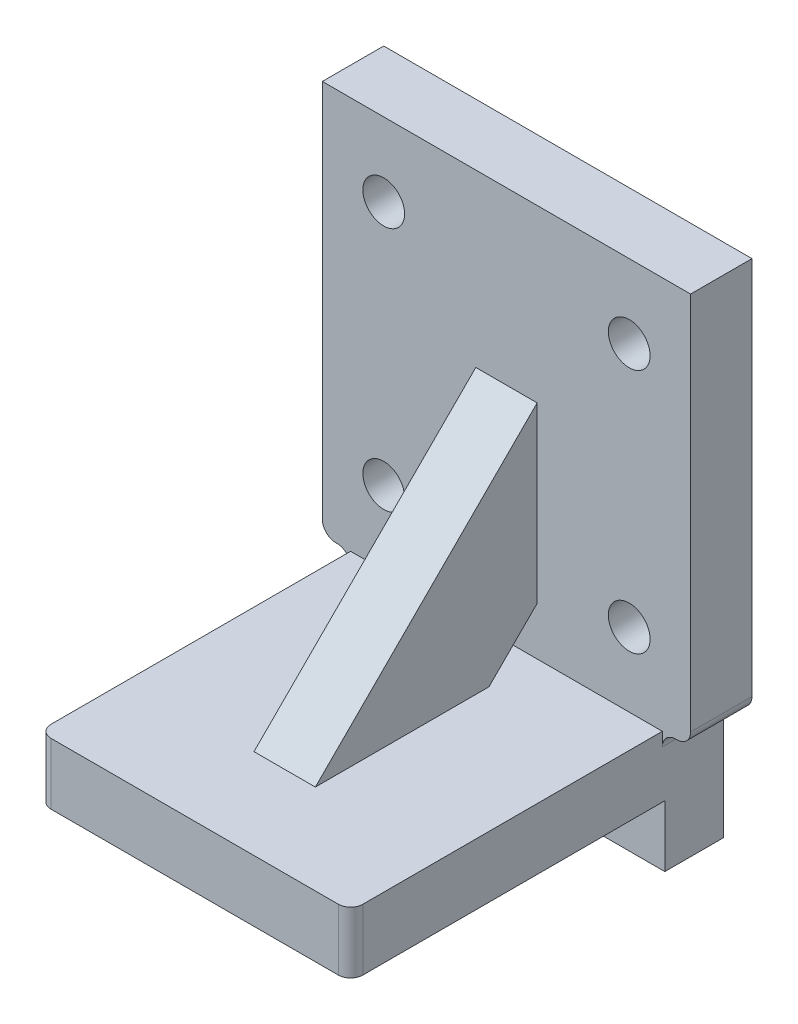
from build123d import *

# Parameters (mm, degrees)
SKETCH1_W                       = 30
SKETCH1_H                       = 32
BOSS_EXTRUDE1_DEPTH             = 5
M3_CLEARANCE_HOLE1_D            = 3.4
SKETCH5_W                       = 25.4
SKETCH5_H                       = 30.4
BOSS_EXTRUDE2_DEPTH             = 5
BOSS_EXTRUDE3_REACH             = 38.377
SKETCH8_W                       = 5
SKETCH8_H                       = 10
BOSS_EXTRUDE3_DIRECTION_2_REACH = 38.377
SKETCH10_W                      = 6.4
SKETCH10_H                      = 19.2
CUT_EXTRUDE1_DEPTH              = 2.7
FILLET1_R                       = 1
SKETCH12_W                      = 25.4
SKETCH12_H                      = 4.8
BOSS_EXTRUDE5_DEPTH             = 5
FILLET2_START                   = -1
FILLET2_DEPTH                   = 30.4
FILLET2_2_DEPTH                 = 5


with BuildPart() as part:
    # Sketch1 → Boss-Extrude1 (new body)
    with BuildSketch(Plane.XY):
        Rectangle(SKETCH1_W, SKETCH1_H)
    extrude(amount=BOSS_EXTRUDE1_DEPTH)

    # M3 Clearance Hole1 (through all)
    with Locations(Plane.XY.offset(5)):
        with Locations((-10, 10), (10, 10), (10, -10), (-10, -10)):
            Hole(M3_CLEARANCE_HOLE1_D / 2)

    # Sketch5 → Boss-Extrude2 (add)
    with BuildSketch(Plane.XZ.offset(16)):
        with Locations((0, 15.2)):
            Rectangle(SKETCH5_W, SKETCH5_H)
    extrude(amount=BOSS_EXTRUDE2_DEPTH)

    # Boss-Extrude3: up to this plane
    boss_extrude3_end = Plane(origin=(0, -16, 0), z_dir=(0, -1, 0))
    # Sketch8 → Boss-Extrude3 (add, up to the surface)
    with BuildSketch(Plane(origin=(0, -10.5, 10.5), x_dir=(1, 0, 0), z_dir=(0, -0.7071067811865475, 0.7071067811865477)), mode=Mode.PRIVATE) as boss_extrude3_sk1:
        Rectangle(SKETCH8_W, SKETCH8_H)
    boss_extrude3_tool1 = split(extrude(boss_extrude3_sk1.sketch, amount=BOSS_EXTRUDE3_REACH, mode=Mode.PRIVATE), bisect_by=boss_extrude3_end, keep=Keep.BOTH, mode=Mode.PRIVATE)
    add(boss_extrude3_tool1.solids().sort_by_distance((0, -10.5, 10.5))[0])

    # Boss-Extrude3 direction 2: up to this plane
    boss_extrude3_direction_2_end = Plane(origin=(0, 0, 5), z_dir=(0, 0, 1))
    # Sketch8 → Boss-Extrude3 direction 2 (add, up to the surface)
    with BuildSketch(Plane(origin=(0, -10.5, 10.5), x_dir=(1, 0, 0), z_dir=(0, -0.7071067811865475, 0.7071067811865477)), mode=Mode.PRIVATE) as boss_extrude3_direction_2_sk1:
        Rectangle(SKETCH8_W, SKETCH8_H)
    boss_extrude3_direction_2_tool1 = split(extrude(boss_extrude3_direction_2_sk1.sketch, amount=-BOSS_EXTRUDE3_DIRECTION_2_REACH, mode=Mode.PRIVATE), bisect_by=boss_extrude3_direction_2_end, keep=Keep.BOTH, mode=Mode.PRIVATE)
    add(boss_extrude3_direction_2_tool1.solids().sort_by_distance((0, -10.5, 10.5))[0])

    # Sketch10 → Cut-Extrude1 (cut)
    with BuildSketch(Plane.XZ.offset(21)):
        with Locations((0, 14.6)):
            Rectangle(SKETCH10_W, SKETCH10_H)
    extrude(amount=-CUT_EXTRUDE1_DEPTH, mode=Mode.SUBTRACT)

    # Fillet1
    fillet1_edges = [part.edges().sort_by_distance(p)[0] for p in [
        (12.7, -18.5, 30.4),
        (-12.7, -18.5, 30.4),
    ]]
    fillet(fillet1_edges, radius=FILLET1_R)

    # Sketch12 → Boss-Extrude5 (add)
    with BuildSketch(Plane.XZ.offset(21)):
        with Locations((0, 2.4)):
            Rectangle(SKETCH12_W, SKETCH12_H)
    extrude(amount=BOSS_EXTRUDE5_DEPTH)

    # Fillet2: read off the stored shape, not the designer's step
    # Fillet2 outline → Fillet2 (cut)
    with BuildSketch(Plane.XY.offset(FILLET2_START)):
        with BuildLine():
            Line((15, -16), (15, -14.9))
            ThreePointArc((15, -14.9), (14.677817459, -15.677817459), (13.9, -16))
            Line((13.9, -16), (15, -16))
        make_face()
        with BuildLine():
            Line((-15, -16), (-13.9, -16))
            ThreePointArc((-13.9, -16), (-14.677817459, -15.677817459), (-15, -14.9))
            Line((-15, -14.9), (-15, -16))
        make_face()
    extrude(amount=FILLET2_DEPTH, mode=Mode.SUBTRACT)

    # Fillet2 2 outline → Fillet2 2 (add)
    with BuildSketch(Plane.XY):
        with BuildLine():
            ThreePointArc((12.7, -17.1), (13.022182541, -16.322182541), (13.8, -16))
            Line((13.8, -16), (12.7, -16))
            Line((12.7, -16), (12.7, -17.1))
        make_face()
        with BuildLine():
            Line((-12.7, -16), (-13.8, -16))
            ThreePointArc((-13.8, -16), (-13.022182541, -16.322182541), (-12.7, -17.1))
            Line((-12.7, -17.1), (-12.7, -16))
        make_face()
    extrude(amount=FILLET2_2_DEPTH)


solid = part.part
